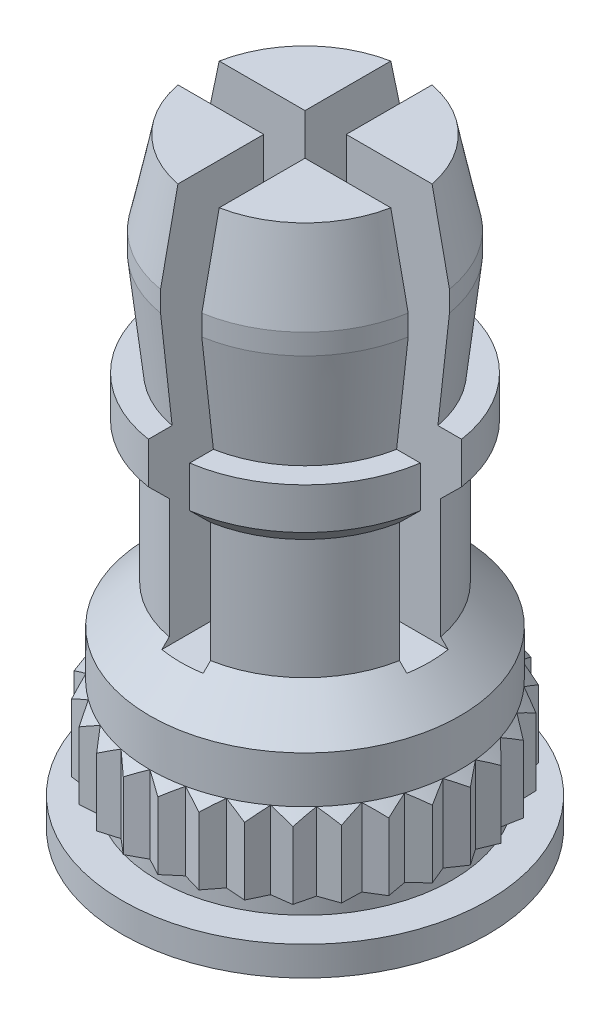
from build123d import *

# Parameters (mm, degrees)
SLITCUTSKE_W       = 5.336948004
SLITCUTSKE_H       = 0.71628
SLITCUT_DEPTH      = 6.860032
SLITCUTPAT_COUNT   = 2
SLITCUTPAT_ANGLE   = 90
CLINCHCUT_START    = -1.3462
CLINCHCUT_DEPTH    = 1.3462
CLINCHCUTPAT_COUNT = 30
CLINCHCUTPAT_ANGLE = 348


with BuildPart() as part:
    # BodySke → Body (revolve)
    with BuildSketch(Plane.XY):
        Polygon((2.55778, 0), (2.55778, 0.381), (2.8702, 0.381), (2.8702, 1.5494), (2.6924, 1.7272), (2.6924, 2.535428), (2.02946, 3.198368), (2.02946, 5.27558), (2.3876, 5.63372), (2.3876, 6.35), (1.9812, 6.35), (2.17932, 8.1407), (2.17932, 8.49884), (1.88214, 9.9314), (0, 9.9314), (0, -0.508), (3.175, -0.508), (3.175, 0), align=None)
    revolve(axis=Axis((0, -0.508, 0), (0, 1, 0)))

    # SlitCutSke → SlitCut (cut)
    with BuildSketch(Plane(origin=(0, 9.9314, 0), x_dir=(-1, 0, 0), z_dir=(0, 1, 0))):
        Rectangle(SLITCUTSKE_W, SLITCUTSKE_H)
    slitcut = extrude(amount=-SLITCUT_DEPTH, mode=Mode.SUBTRACT)

    # SlitCutPat: SlitCut ×2 about axis
    slitcutpat_axis = Axis((0, -0.508, 0), (0, 1, 0))
    for i in range(1, SLITCUTPAT_COUNT):
        add(slitcut.rotate(slitcutpat_axis, i * SLITCUTPAT_ANGLE / (SLITCUTPAT_COUNT - 1)), mode=Mode.SUBTRACT)

    # CliRinCutSke → ClinchCut (cut)
    with BuildSketch(Plane.XZ.offset(-0.381).offset(CLINCHCUT_START)):
        with BuildLine():
            Line((0.300017595, 2.854476744), (0, 2.6924))
            Line((0, 2.6924), (-0.300017595, 2.854476744))
            ThreePointArc((-0.300017595, 2.854476744), (0, 2.8702), (0.300017595, 2.854476744))
        make_face()
    clinchcut = extrude(amount=CLINCHCUT_DEPTH, mode=Mode.SUBTRACT)

    # ClinchCutPat: ClinchCut ×30 about axis
    clinchcutpat_axis = Axis((0, -0.508, 0), (0, 1, 0))
    for i in range(1, CLINCHCUTPAT_COUNT):
        add(clinchcut.rotate(clinchcutpat_axis, i * CLINCHCUTPAT_ANGLE / (CLINCHCUTPAT_COUNT - 1)), mode=Mode.SUBTRACT)


solid = part.part
